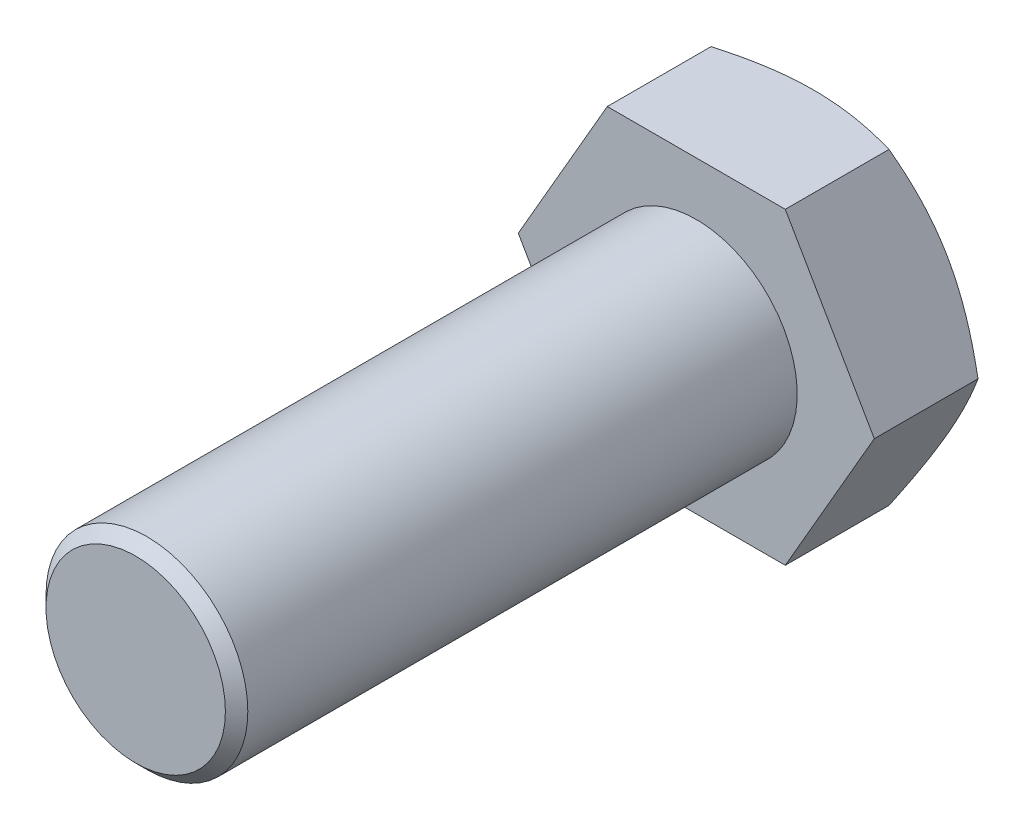
from build123d import *

# Parameters (mm, degrees)
EXTRUDE_1_DEPTH = 22.5
SKETCH_2_R      = 18
EXTRUDE_2_DEPTH = 100
CHAMFER_1_SIZE  = 2


# Read off the part's stored shape, not the designer's step: 切除-旋转-薄壁1
with BuildPart() as part:
    # 草图1 → 拉伸1 (new body)
    with BuildSketch(Plane.XY):
        Polygon((31.754264805, 0), (15.877132403, 27.5), (-15.877132403, 27.5), (-31.754264805, 0), (-15.877132403, -27.5), (15.877132403, -27.5), align=None)
    extrude(amount=EXTRUDE_1_DEPTH)

    # 草图2 → 拉伸2 (add)
    with BuildSketch(Plane.XY.offset(22.5)):
        with Locations(Location((0, 0, 0), (0, 0, 180))):
            Circle(SKETCH_2_R)
    extrude(amount=EXTRUDE_2_DEPTH)

    # 切除-旋转-薄壁1 outline → 切除-旋转-薄壁1 (revolve, cut)
    with BuildSketch(Plane.XZ):
        Polygon((31.754264936, 4.000000075), (24.826061575, 0), (31.754264936, 0), align=None)
    revolve(axis=Axis((0, 0, 0), (0, 0, 1)), mode=Mode.SUBTRACT)

    # 倒角1
    chamfer_1_edges = [part.edges().sort_by_distance(p)[0] for p in [
        (18, 0, 122.5),
    ]]
    chamfer(chamfer_1_edges, length=CHAMFER_1_SIZE)


solid = part.part
